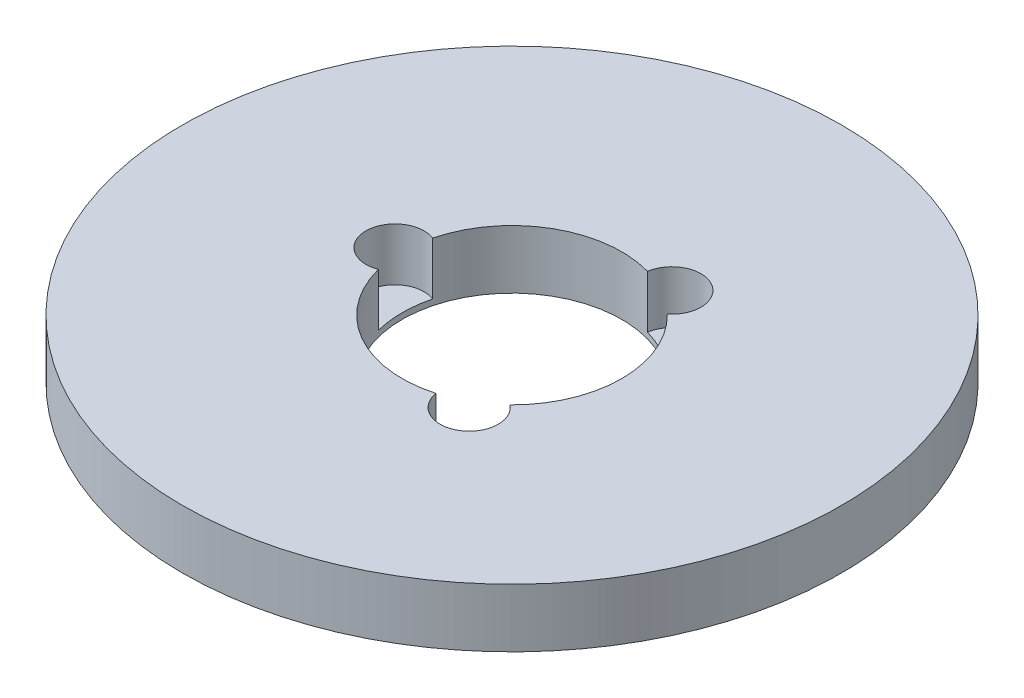
from build123d import *

# Parameters (mm, degrees)
SKETCH1_R           = 90
BOSS_EXTRUDE1_DEPTH = 16
SKETCH2_R           = 30
CUT_EXTRUDE1_DEPTH  = 129.280941687
SKETCH3_R           = 7.940255577
CUT_EXTRUDE2_DEPTH  = 14.399821738
CIRPATTERN1_COUNT   = 3


with BuildPart() as part:
    # Sketch1 → Boss-Extrude1 (new body)
    with BuildSketch(Plane(origin=(0, 0, 0), x_dir=(1, 0, 0), z_dir=(0, 1, 0))):
        Circle(SKETCH1_R)
    extrude(amount=BOSS_EXTRUDE1_DEPTH)

    # Sketch2 → Cut-Extrude1 (cut, through all)
    with BuildSketch(Plane(origin=(0, 0, 0), x_dir=(1, 0, 0), z_dir=(0, 1, 0))):
        Circle(SKETCH2_R)
    extrude(amount=CUT_EXTRUDE1_DEPTH, mode=Mode.SUBTRACT)

    # Sketch3 → Cut-Extrude2 (cut)
    with BuildSketch(Plane(origin=(0, 16, 0), x_dir=(1, 0, 0), z_dir=(0, 1, 0))):
        with Locations((-31.956095659, 0)):
            Circle(SKETCH3_R)
    cut_extrude2 = extrude(amount=-CUT_EXTRUDE2_DEPTH, mode=Mode.SUBTRACT)

    # CirPattern1: Cut-Extrude2 ×3 about axis
    cirpattern1_axis = Axis((0, 0, 0), (0, 1, 0))
    for i in range(1, CIRPATTERN1_COUNT):
        add(cut_extrude2.rotate(cirpattern1_axis, i * 360 / CIRPATTERN1_COUNT), mode=Mode.SUBTRACT)


solid = part.part
